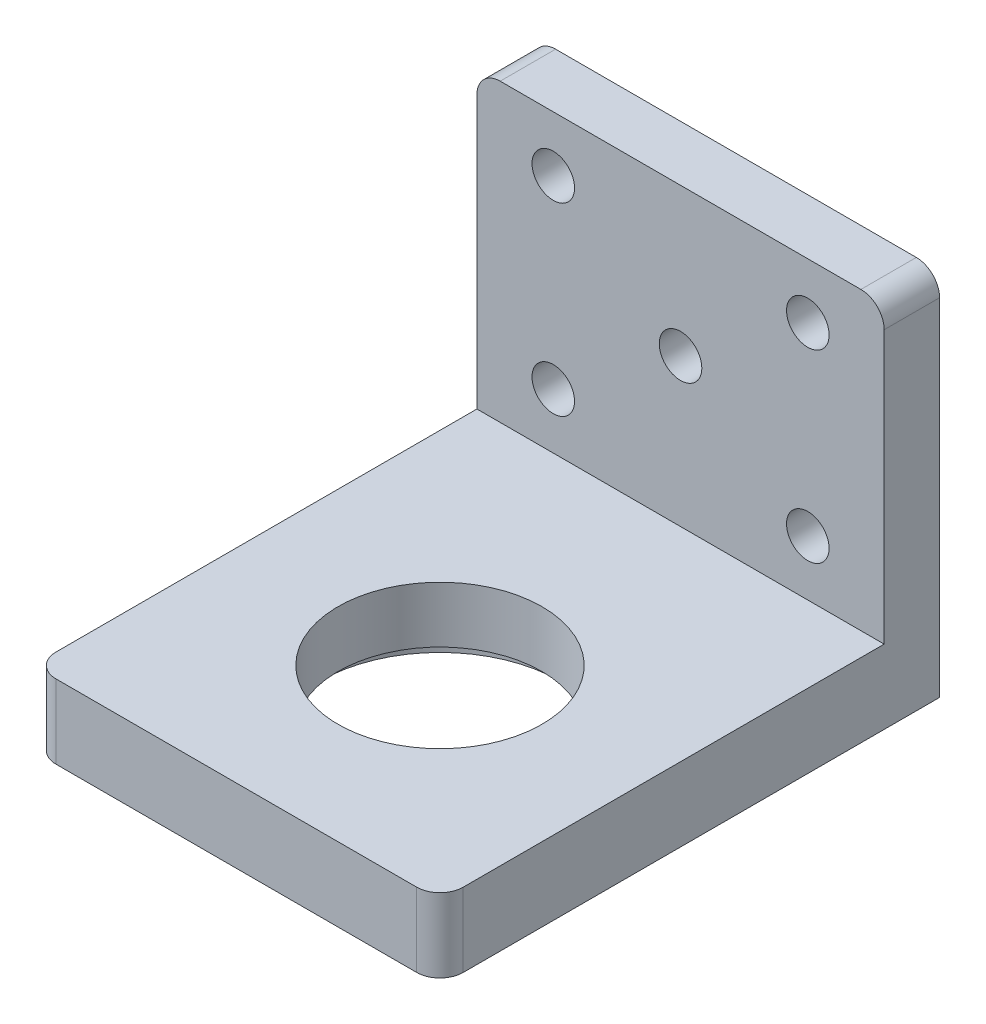
from build123d import *

# Parameters (mm, degrees)
SKETCH1_W             = 35
SKETCH1_H             = 42.9375
BOSS_EXTRUDE1_DEPTH   = 6.35
SKETCH2_W             = 35
SKETCH2_H             = 4.7625
BOSS_EXTRUDE2_DEPTH   = 25.4
SKETCH3_R             = 8.763
CUT_EXTRUDE1_DEPTH    = 64.848973416
F_6_CLEARANCE_HOLE1_D = 3.6576
SKETCH13_R            = 10.3505
SKETCH13_R_2          = 8.763
CUT_EXTRUDE2_DEPTH    = 1.524
FILLET2_R             = 2


with BuildPart() as part:
    # Sketch1 → Boss-Extrude1 (new body)
    with BuildSketch(Plane(origin=(0, 0, 0), x_dir=(1, 0, 0), z_dir=(0, 1, 0))):
        with Locations((17.5, 21.46875)):
            Rectangle(SKETCH1_W, SKETCH1_H)
    extrude(amount=BOSS_EXTRUDE1_DEPTH)

    # Sketch2 → Boss-Extrude2 (add)
    with BuildSketch(Plane(origin=(0, 6.35, 0), x_dir=(1, 0, 0), z_dir=(0, 1, 0))):
        with Locations((17.5, 40.55625)):
            Rectangle(SKETCH2_W, SKETCH2_H)
    extrude(amount=BOSS_EXTRUDE2_DEPTH)

    # Sketch3 → Cut-Extrude1 (cut, through all)
    with BuildSketch(Plane.XZ):
        with Locations((17.5, -17.5)):
            Circle(SKETCH3_R)
    extrude(amount=-CUT_EXTRUDE1_DEPTH, mode=Mode.SUBTRACT)

    # #6 Clearance Hole1 (through all)
    with Locations(Plane.XY.offset(-38.175)):
        with Locations((6.5625, 26.9875), (17.5, 19.05), (6.5625, 11.1125), (28.4375, 26.9875), (28.4375, 11.1125)):
            Hole(F_6_CLEARANCE_HOLE1_D / 2)

    # Sketch13 → Cut-Extrude2 (cut)
    with BuildSketch(Plane.XZ):
        with Locations((17.5, -17.5)):
            Circle(SKETCH13_R)
        with Locations((17.5, -17.5)):
            Circle(SKETCH13_R_2, mode=Mode.SUBTRACT)
    extrude(amount=-CUT_EXTRUDE2_DEPTH, mode=Mode.SUBTRACT)

    # Fillet2
    fillet2_edges = [part.edges().sort_by_distance(p)[0] for p in [
        (35, 3.175, 0),
        (0, 3.175, 0),
        (0, 31.75, -40.55625),
        (35, 31.75, -40.55625),
    ]]
    fillet(fillet2_edges, radius=FILLET2_R)


solid = part.part
